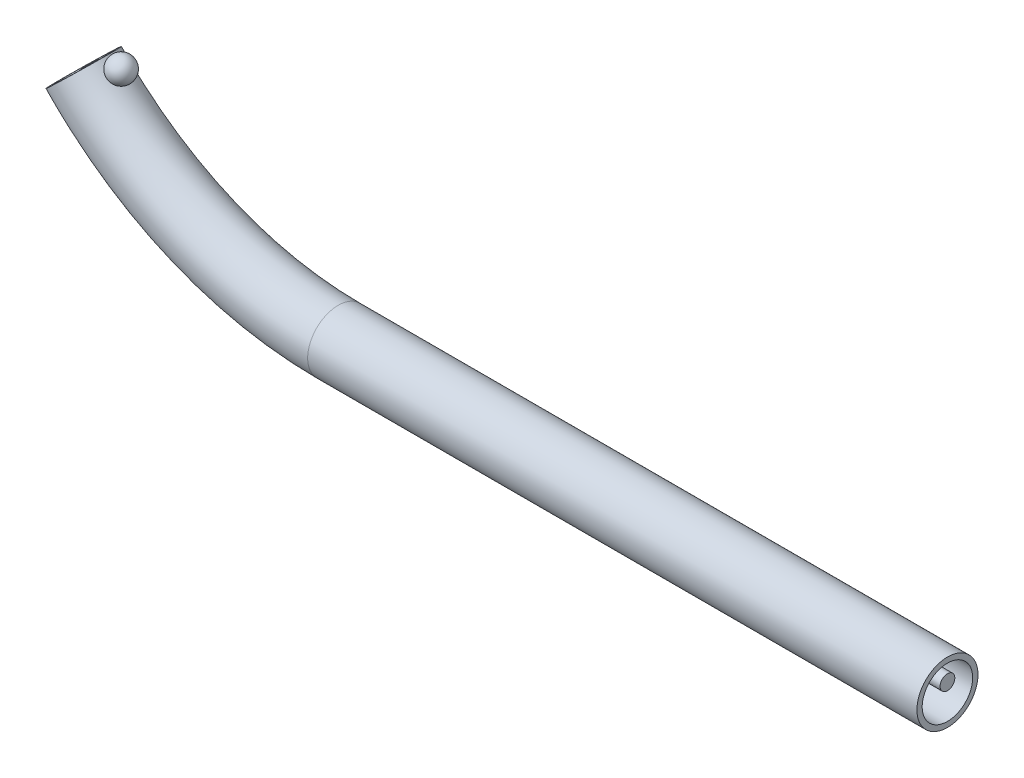
from build123d import *

# Parameters (mm, degrees)
SKETCH5_R           = 0.6223
SKETCH5_R_2         = 0.51435
SKETCH5_2_R         = 0.6223
SKETCH5_2_R_2       = 0.51435
BOSS_EXTRUDE2_DEPTH = 10
SKETCH8_R           = 0.15


with BuildPart() as part:
    # Sweep2: sweep along a path in Sketch4
    with BuildLine(Plane.XY) as sweep2_path:
        Line((-65.954222951, 0), (-68.364968213, 0))
        ThreePointArc((-68.364968213, 0), (-71.186123393, 0.579815367), (-73.549932813, 2.225265895))
    # Sketch5 → Sweep2 (sweep)
    with BuildSketch(Plane(origin=(-65.954222951, 0, 0), x_dir=(0, 0, -1), z_dir=(1, 0, 0))):
        Circle(SKETCH5_R)
        Circle(SKETCH5_R_2, mode=Mode.SUBTRACT)
    sweep(path=sweep2_path.line)

    # Sketch5<2> → Boss-Extrude2 (add)
    with BuildSketch(Plane(origin=(-65.954222951, 0, 0), x_dir=(0, 0, -1), z_dir=(1, 0, 0))):
        Circle(SKETCH5_2_R)
        Circle(SKETCH5_2_R_2, mode=Mode.SUBTRACT)
    extrude(amount=BOSS_EXTRUDE2_DEPTH)

    # Sketch6 → Revolve2 (revolve)
    with BuildSketch(Plane.XY):
        with BuildLine():
            Line((-72.949063517, 2.38792888), (-72.625665662, 2.76926053))
            ThreePointArc((-72.625665662, 2.76926053), (-72.596698765, 2.416895777), (-72.949063517, 2.38792888))
        make_face()
    revolve(axis=Axis((-72.949063517, 2.38792888, 0), (0.6467957105420484, 0.7626632997754689, 0)))


with BuildPart() as body_2:
    # Sweep3: sweep along a path in Sketch7
    with BuildLine(Plane.XY) as sweep3_path:
        Line((-55.954222951, 0.1777), (-68.364968213, 0.1777))
        ThreePointArc((-68.364968213, 0.1777), (-71.116040444, 0.743111633), (-73.421128268, 2.347685988))
    # Sketch8 → Sweep3 (sweep)
    with BuildSketch(Plane(origin=(-36.018221468, 37.89664365, 0), x_dir=(0.7248426853938525, 0.688914422429251, 0), z_dir=(-0.688914422429251, 0.7248426853938525, 0))):
        with Locations((-51.601413042, 0)):
            Circle(SKETCH8_R)
    sweep(path=sweep3_path.line)


solid = Compound([part.part, body_2.part])
